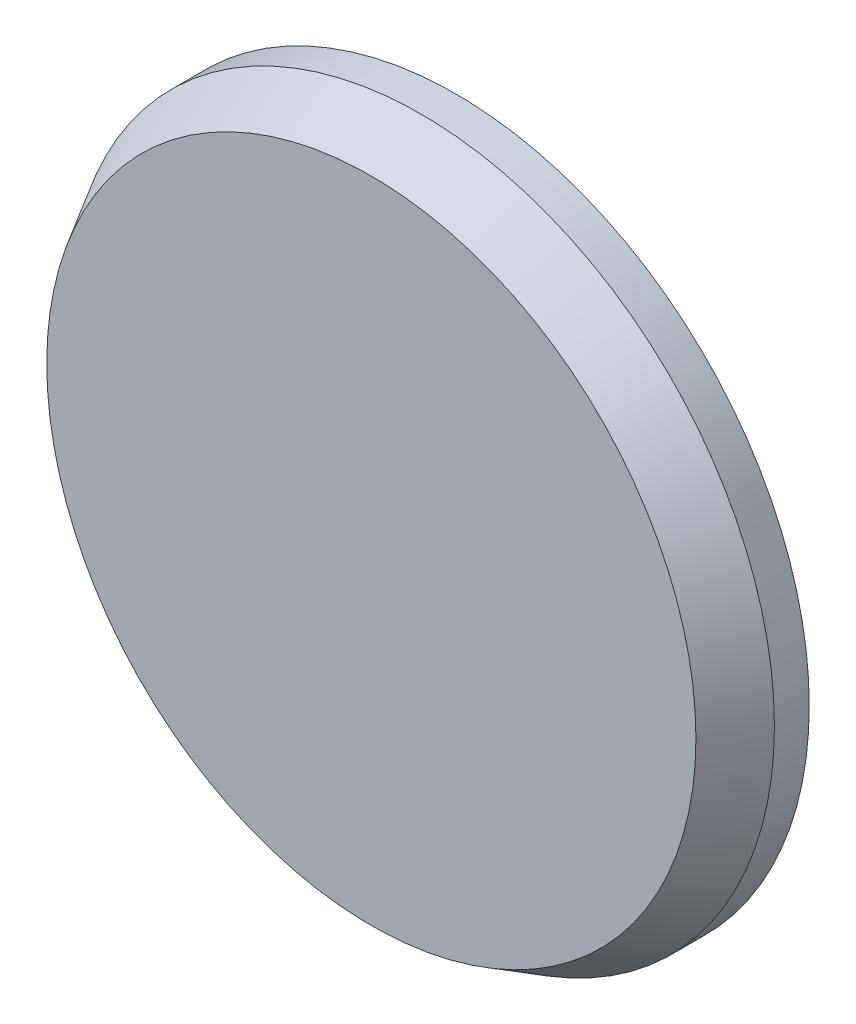
from build123d import *

# Parameters (mm, degrees)
SKETCH1_R           = 17.75
BOSS_EXTRUDE1_DEPTH = 4.25
CUT_EXTRUDE1_DEPTH  = 2.75
CHAMFER1_SIZE       = 2.5
CHAMFER1_SIZE2      = 1.443375673


with BuildPart() as part:
    # Sketch1 → Boss-Extrude1 (new body)
    with BuildSketch(Plane.XY):
        Circle(SKETCH1_R)
    extrude(amount=BOSS_EXTRUDE1_DEPTH)

    # Sketch2 → Cut-Extrude1 (cut)
    with BuildSketch(Plane(origin=(0, 0, 0), x_dir=(-1, 0, 0), z_dir=(0, 0, -1))):
        Polygon((1.15, -1.15), (14.504482066, -1.15), (14.504482066, 1.15), (1.15, 1.15), (1.15, 14.504482066), (-1.15, 14.504482066), (-1.15, 1.15), (-14.504482066, 1.15), (-14.504482066, -1.15), (-1.15, -1.15), (-1.15, -14.504482066), (1.15, -14.504482066), align=None)
    extrude(amount=-CUT_EXTRUDE1_DEPTH, mode=Mode.SUBTRACT)

    # Chamfer1
    chamfer1_edges = [part.edges().sort_by_distance(p)[0] for p in [
        (-17.75, 0, 4.25),
    ]]
    chamfer1_side = [part.faces().sort_by_distance(p)[0] for p in [
        (-17.75, 0, 2.125),
    ]]
    chamfer(chamfer1_edges, length=CHAMFER1_SIZE, length2=CHAMFER1_SIZE2, reference=chamfer1_side[0])


solid = part.part
